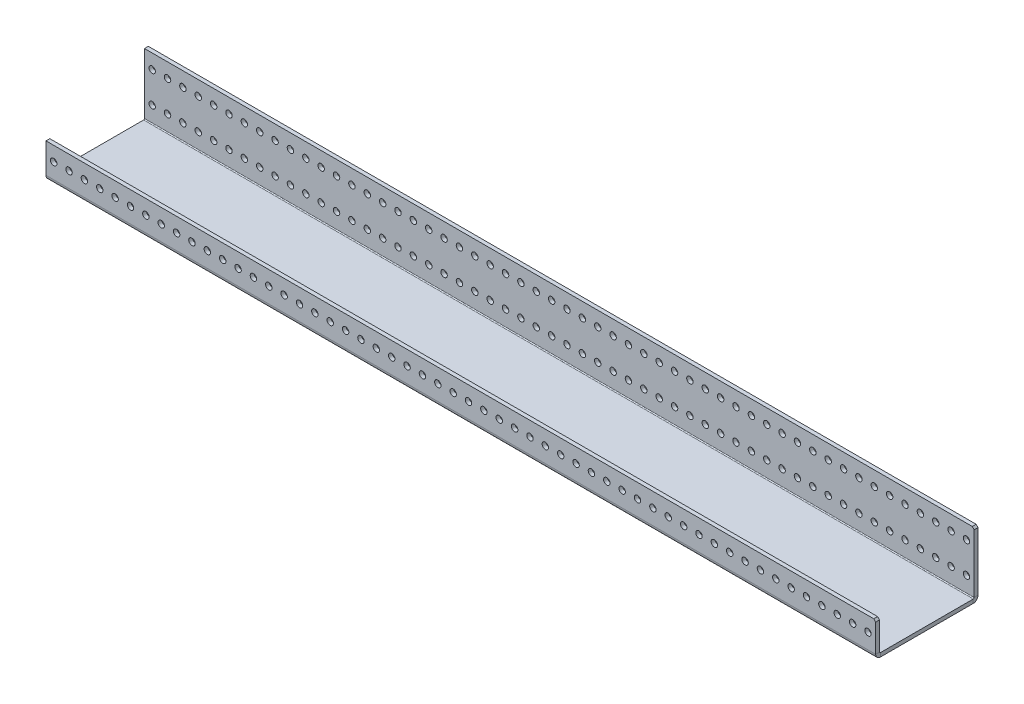
from build123d import *

# Parameters (mm, degrees)
SKETCH1_W                    = 787.4
SKETCH1_H                    = 78.232
BOSS_EXTRUDE1_DEPTH          = 3.175
EDGE_FLANGE1_STRIP_W         = 14.224
EDGE_FLANGE1_STRIP_H         = 3.175
EDGE_FLANGE1_STRIP_CUT_DEPTH = 787.4
EDGE_FLANGE1_DEPTH           = 787.4
EDGE_FLANGE2_STRIP_W         = 14.224
EDGE_FLANGE2_STRIP_H         = 3.175
EDGE_FLANGE2_STRIP_CUT_DEPTH = 787.4
EDGE_FLANGE2_DEPTH           = 787.4
SKETCH9_R                    = 2.667
CUT_EXTRUDE1_DEPTH           = 794.767078776
CHAMFER1_SIZE                = 1.5875
LPATTERN1_COUNT              = 62
LPATTERN1_PITCH              = 12.7
SKETCH10_W                   = 101.6
SKETCH10_H                   = 125.202186064
CUT_EXTRUDE2_DEPTH           = 794.767078776
SKETCH14_R                   = 2.667
CUT_EXTRUDE6_DEPTH           = 5.08
LPATTERN4_COUNT              = 62
LPATTERN4_PITCH              = 12.7


# Sheet-metal steps are written as plain solids
with BuildPart() as part:
    # Sketch1 → Boss-Extrude1 (new body)
    with BuildSketch(Plane(origin=(0, 0, 0), x_dir=(1, 0, 0), z_dir=(0, 1, 0))):
        with Locations((393.7, 39.116)):
            Rectangle(SKETCH1_W, SKETCH1_H)
    extrude(amount=BOSS_EXTRUDE1_DEPTH)

    # Edge-Flange1 strip (across the edge) → Edge-Flange1 strip cut (cut)
    with BuildSketch(Plane(origin=(787.4, 3.175, -78.232), x_dir=(0, 0, 1), z_dir=(-1, 0, 0))):
        with Locations((-6.35, -1.5875)):
            Rectangle(EDGE_FLANGE1_STRIP_W, EDGE_FLANGE1_STRIP_H)
    extrude(amount=EDGE_FLANGE1_STRIP_CUT_DEPTH, mode=Mode.SUBTRACT)

    # Edge-Flange1 section (across the edge) → Edge-Flange1 (add)
    with BuildSketch(Plane(origin=(787.4, 3.175, -78.232), x_dir=(0, 0, 1), z_dir=(-1, 0, 0))):
        with BuildLine():
            Line((-3.175, 0.762), (-3.175, 50.8))
            Line((-3.175, 50.8), (0, 50.8))
            Line((0, 50.8), (0, 0.762))
            ThreePointArc((0, 0.762), (0.223184633, 0.223184633), (0.762, 0))
            Line((0.762, 0), (0.762, -3.175))
            ThreePointArc((0.762, -3.175), (-2.021879398, -2.021879398), (-3.175, 0.762))
        make_face()
    extrude(amount=EDGE_FLANGE1_DEPTH)

    # Edge-Flange2 strip (across the edge) → Edge-Flange2 strip cut (cut)
    with BuildSketch(Plane(origin=(0, 3.175, 0), x_dir=(0, 0, -1), z_dir=(1, 0, 0))):
        with Locations((-6.35, -1.5875)):
            Rectangle(EDGE_FLANGE2_STRIP_W, EDGE_FLANGE2_STRIP_H)
    extrude(amount=EDGE_FLANGE2_STRIP_CUT_DEPTH, mode=Mode.SUBTRACT)

    # Edge-Flange2 section (across the edge) → Edge-Flange2 (add)
    with BuildSketch(Plane(origin=(0, 3.175, 0), x_dir=(0, 0, -1), z_dir=(1, 0, 0))):
        with BuildLine():
            Line((-3.175, 0.762), (-3.175, 25.4))
            Line((-3.175, 25.4), (0, 25.4))
            Line((0, 25.4), (0, 0.762))
            ThreePointArc((0, 0.762), (0.223184633, 0.223184633), (0.762, 0))
            Line((0.762, 0), (0.762, -3.175))
            ThreePointArc((0.762, -3.175), (-2.021879398, -2.021879398), (-3.175, 0.762))
        make_face()
    extrude(amount=EDGE_FLANGE2_DEPTH)

    # Sketch9 → Cut-Extrude1 (cut, through all)
    with BuildSketch(Plane.XY.offset(3.175)):
        with Locations((781.05, 16.637)):
            Circle(SKETCH9_R)
    cut_extrude1 = extrude(amount=-CUT_EXTRUDE1_DEPTH, mode=Mode.SUBTRACT)

    # Chamfer1
    chamfer1_edges = [part.edges().sort_by_distance(p)[0] for p in [
        (787.4, 53.975, -79.8195),
        (0, 53.975, -79.8195),
        (0, 28.575, 1.5875),
        (787.4, 28.575, 1.5875),
    ]]
    chamfer(chamfer1_edges, length=CHAMFER1_SIZE)

    # LPattern1: Cut-Extrude1 ×62
    with Locations(*[(-i * LPATTERN1_PITCH, 0, 0) for i in range(1, LPATTERN1_COUNT)]):
        add(cut_extrude1, mode=Mode.SUBTRACT)

    # Sketch10 → Cut-Extrude2 (cut, through all)
    with BuildSketch(Plane.XY.offset(3.175)):
        with Locations((50.8, 62.601093032)):
            Rectangle(SKETCH10_W, SKETCH10_H)
    extrude(amount=-CUT_EXTRUDE2_DEPTH, mode=Mode.SUBTRACT)

    # Sketch14 → Cut-Extrude6 (cut)
    with BuildSketch(Plane(origin=(0, 0, -81.407), x_dir=(-1, 0, 0), z_dir=(0, 0, -1))):
        with Locations(Location((-781.05, 42.037, 0), (0, 0, 90))):
            Circle(SKETCH14_R)
    cut_extrude6 = extrude(amount=-CUT_EXTRUDE6_DEPTH, mode=Mode.SUBTRACT)

    # LPattern4: Cut-Extrude6 ×62
    with Locations(*[(-i * LPATTERN4_PITCH, 0, 0) for i in range(1, LPATTERN4_COUNT)]):
        add(cut_extrude6, mode=Mode.SUBTRACT)


solid = part.part
